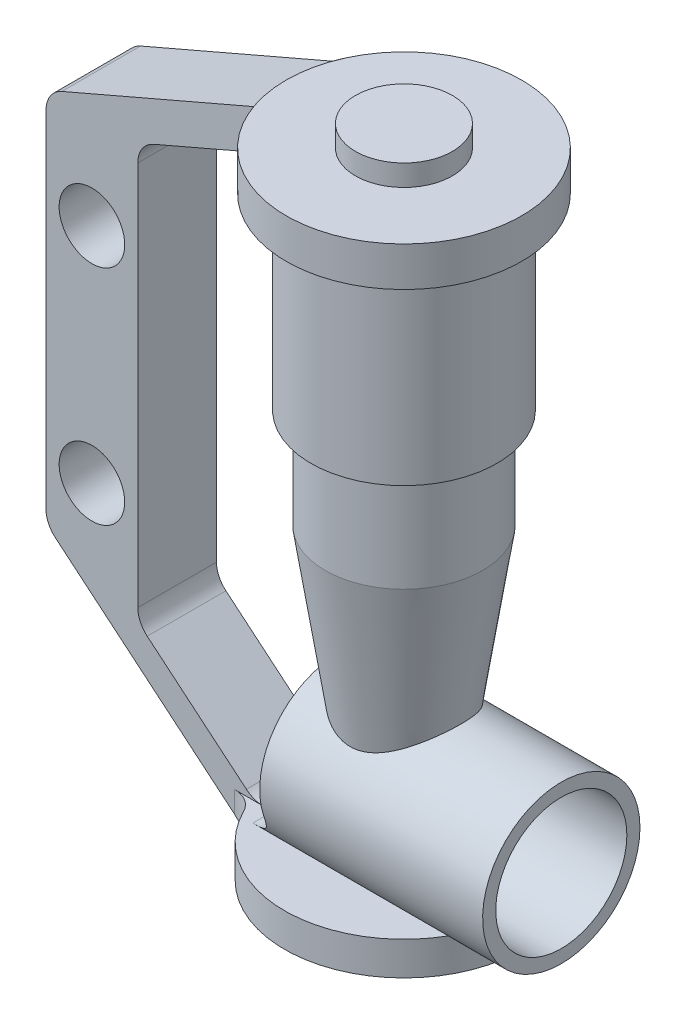
from build123d import *

# Parameters (mm, degrees)
BOSS_EXTRUDE1_DEPTH      = 15
BOSS_EXTRUDE1_DEPTH_BACK = 15
SKETCH3_R                = 12.5
SKETCH4_R                = 30
SKETCH4_R_2              = 25
BOSS_EXTRUDE2_DEPTH      = 60
BOSS_EXTRUDE3_DEPTH      = 5
BOSS_EXTRUDE3_DEPTH_BACK = 25
SKETCH5_R                = 30
FILLET1_R                = 10
CUT_EXTRUDE1_START       = -65
SKETCH6_R                = 25
CUT_EXTRUDE1_DEPTH       = 65


with BuildPart() as part:
    # Sketch2 → Revolve1 (revolve)
    with BuildSketch(Plane.XY, mode=Mode.PRIVATE) as revolve1_sk:
        Polygon((0, 47.481515712), (18.484288355, 47.481515712), (18.484288355, 39.394639556), (44.872104392, 39.394639556), (44.872104392, 24.346445364), (35.445928293, 24.346445364), (35.445928293, -47.074965844), (30.007749775, -47.074965844), (30.007749775, -85.142215473), (18.546286043, -160.936690765), (18.546286043, -189.740958038), (45.517560074, -189.740958038), (45.517560074, -202.518484288), (0, -202.518484288), align=None)
    revolve(revolve1_sk.sketch.rotate(Axis((0, 47.481515712, 0), (0, -1, 0)), 180), axis=Axis((0, 47.481515712, 0), (0, -1, 0)))

    # Sketch3 → Boss-Extrude1 (add, two sides: drawn at the far end of the back side and taken through both)
    with BuildSketch(Plane.XY.offset(-BOSS_EXTRUDE1_DEPTH_BACK)):
        Polygon((-42.28533841, 24.346445364), (-86.474429819, 5.279737536), (-86.474429819, -152.790196511), (-42.28533841, -189.740958038), (-42.28533841, -202.518484288), (-44.080740722, -202.518484288), (-121.474429819, -137.802155929), (-121.474429819, 5.226132785), (-42.28533841, 39.394639556), align=None)
        with Locations((-103.974429819, -30.80530006)):
            Circle(SKETCH3_R, mode=Mode.SUBTRACT)
        with Locations((-103.974429819, -115.80530006)):
            Circle(SKETCH3_R, mode=Mode.SUBTRACT)
    extrude(amount=BOSS_EXTRUDE1_DEPTH + BOSS_EXTRUDE1_DEPTH_BACK)

    # Sketch4 → Boss-Extrude2 (add)
    with BuildSketch(Plane(origin=(0, 0, 0), x_dir=(0, 0, -1), z_dir=(1, 0, 0))):
        with Locations(Location((0, -170, 0), (0, 0, 221.149949101))):
            Circle(SKETCH4_R)
        with Locations(Location((0, -170, 0), (0, 0, 141.388518695))):
            Circle(SKETCH4_R_2, mode=Mode.SUBTRACT)
    extrude(amount=BOSS_EXTRUDE2_DEPTH)

    # Sketch5 → Boss-Extrude3 (add, two sides: drawn at the far end of the back side and taken through both)
    with BuildSketch(Plane(origin=(0, 0, 0), x_dir=(0, 0, -1), z_dir=(1, 0, 0)).offset(-BOSS_EXTRUDE3_DEPTH_BACK)):
        with Locations(Location((0, -170, 0), (0, 0, 221.149949101))):
            Circle(SKETCH5_R)
    extrude(amount=BOSS_EXTRUDE3_DEPTH + BOSS_EXTRUDE3_DEPTH_BACK)

    # Fillet1
    # the kernel refuses this fillet: 10 mm, written as the material it adds along each edge
    with BuildSketch(Plane(origin=(-42.974972659, -189.740958038, 15), x_dir=(-1, 0, 0), z_dir=(0, -1, 0))) as fillet1_piece_1_section:
        with BuildLine():
            CenterArc((6.59517437, -10), FILLET1_R, 90, 63.23655504)
            ThreePointArc((-2.333558622, -5.49692026), (-1.076535169, -2.786770672), (0, 0))
            Line((0, 0), (6.59517437, 0))
        make_face()
    fillet1_piece_1 = extrude(amount=12.777526251, mode=Mode.PRIVATE)
    fillet1_piece_1 = split(fillet1_piece_1, bisect_by=Plane(origin=(-48.522573574, -198.80423941, 19.040168561), z_dir=(0.6414797327096047, 0.7671399823518614, 0)), keep=Keep.TOP, mode=Mode.PRIVATE)
    add(fillet1_piece_1)
    with BuildSketch(Plane(origin=(-42.974972659, -189.740958038, -15), x_dir=(0.3907672257300362, 0, -0.9204895302474932), z_dir=(0, -1, 0))) as fillet1_piece_2_section:
        with BuildLine():
            CenterArc((6.627717311, -9.978461215), FILLET1_R, 93.76119811, 63.23655504)
            Line((-2.577177992, -6.070788958), (0, 0))
            ThreePointArc((0, 0), (2.985867888, -0.098039292), (5.971735777, 0))
        make_face()
    fillet1_piece_2 = extrude(amount=12.777526251, mode=Mode.PRIVATE)
    fillet1_piece_2 = split(fillet1_piece_2, bisect_by=Plane(origin=(-48.522573573, -198.80423941, -19.04016856), z_dir=(0.6414797327096047, 0.7671399823518614, 0)), keep=Keep.TOP, mode=Mode.PRIVATE)
    add(fillet1_piece_2)
    with BuildSketch(Plane(origin=(-86.474429819, 5.279737536, 15), x_dir=(0.9181753374265987, 0.39617426688460156, 0), z_dir=(0, 0, -1))) as fillet1_piece_3:
        with BuildLine():
            CenterArc((FILLET1_R * 0.657636628324, FILLET1_R), FILLET1_R, 203.339230224, 66.660769776)
            Line((-FILLET1_R * 0.260538709103, FILLET1_R * 0.603825733115), (0, 0))
            Line((0, 0), (FILLET1_R * 0.657636628324, 0))
        make_face()
    extrude(amount=30)
    with BuildSketch(Plane(origin=(-86.474429819, -152.790196511, 15), x_dir=(0, 1, 0), z_dir=(0, 0, -1))) as fillet1_piece_4:
        with BuildLine():
            CenterArc((FILLET1_R * 0.467346606276, FILLET1_R), FILLET1_R, 219.902248143, 50.097751857)
            Line((-FILLET1_R * 0.299793376076, FILLET1_R * 0.35852026729), (0, 0))
            Line((0, 0), (FILLET1_R * 0.467346606276, 0))
        make_face()
    extrude(amount=30)
    with BuildSketch(Plane(origin=(-42.28533841, -189.740958038, 15), x_dir=(-0.7671399823518606, 0.6414797327096056, 0), z_dir=(0, 0, -1))) as fillet1_piece_5:
        with BuildLine():
            CenterArc((FILLET1_R * 0.363004481318, FILLET1_R), FILLET1_R, 230.097751857, 39.902248143)
            Line((-FILLET1_R * 0.278475251392, FILLET1_R * 0.232860017648), (0, 0))
            Line((0, 0), (FILLET1_R * 0.363004481318, 0))
        make_face()
    extrude(amount=30)
    with BuildSketch(Plane(origin=(-25, -189.740958038, 47.589700656), x_dir=(-1, 0, 0), z_dir=(0, 0, -1))) as fillet1_piece_6_section:
        with BuildLine():
            CenterArc((FILLET1_R, FILLET1_R), FILLET1_R, 180, 90)
            Line((0, FILLET1_R), (0, 0))
            Line((0, 0), (FILLET1_R, 0))
        make_face()
    fillet1_piece_6 = extrude(amount=95.179401313, mode=Mode.PRIVATE)
    fillet1_piece_6 = fillet1_piece_6 & Plane(origin=(-27.186425599, -170, 0), x_dir=(0, -0.6580319345943207, 0.7529900218821333), z_dir=(-1, 0, 0)) * Cylinder(30, 231, mode=Mode.PRIVATE)
    add(fillet1_piece_6)
    # the kernel refuses this fillet: 10 mm, written as the material it takes off along each edge
    with BuildSketch(Plane(origin=(-121.474429819, -137.802155929, 26.683665157), x_dir=(0, 1, 0), z_dir=(0, 0, -1))) as fillet1_2_piece_1:
        with BuildLine():
            CenterArc((FILLET1_R * 0.467346606276, FILLET1_R), FILLET1_R, 219.902248143, 50.097751857)
            Line((-FILLET1_R * 0.299793376076, FILLET1_R * 0.35852026729), (0, 0))
            Line((0, 0), (FILLET1_R * 0.467346606276, 0))
        make_face()
    extrude(amount=53.367330314, mode=Mode.SUBTRACT)
    with BuildSketch(Plane(origin=(-121.474429819, 5.226132785, -31.440915708), x_dir=(0, -1, 0), z_dir=(0, 0, 1))) as fillet1_2_piece_2:
        with BuildLine():
            CenterArc((FILLET1_R * 0.657636628324, FILLET1_R), FILLET1_R, 203.339230224, 66.660769776)
            Line((-FILLET1_R * 0.260538709103, FILLET1_R * 0.603825733115), (0, 0))
            Line((0, 0), (FILLET1_R * 0.657636628324, 0))
        make_face()
    extrude(amount=62.881831416, mode=Mode.SUBTRACT)

    # Sketch6 → Cut-Extrude1 (cut)
    with BuildSketch(Plane(origin=(60, 0, 0), x_dir=(0, 0, -1), z_dir=(1, 0, 0)).offset(CUT_EXTRUDE1_START)):
        with Locations((0, -170)):
            Circle(SKETCH6_R)
    extrude(amount=CUT_EXTRUDE1_DEPTH, mode=Mode.SUBTRACT)


solid = part.part
